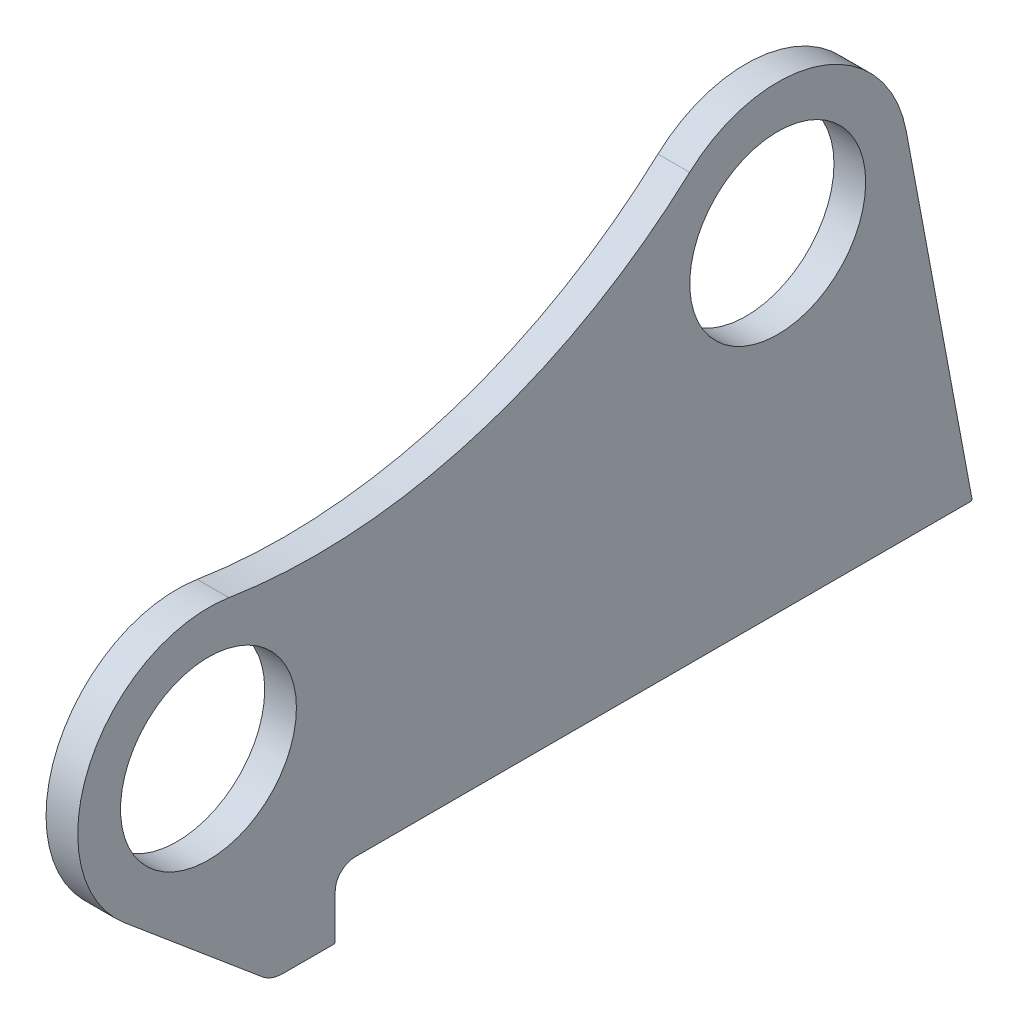
from build123d import *

# Parameters (mm, degrees)
SKETCH1_R          = 55.5
BASE_FLANGE1_DEPTH = 20
FILLET_1_0_R       = 1


# Sheet-metal steps are written as plain solids
with BuildPart() as part:
    # Sketch1 → Base-Flange1 (new body)
    with BuildSketch(Plane(origin=(0, 0, 0), x_dir=(0, 0, -1), z_dir=(1, 0, 0))):
        with BuildLine():
            Line((0, -41), (0, -12.5))
            ThreePointArc((0, -12.5), (3.661165235, -3.661165235), (12.5, 0))
            Line((12.5, 0), (402, 0))
            Line((402, 0), (360.323614104, 222.774084629))
            ThreePointArc((360.323614104, 222.774084629), (305.433470455, 285.831465011), (223.63616123, 268.558327081))
            ThreePointArc((223.63616123, 268.558327081), (88.211160813, 191.873835227), (-67.07058856, 181.480551789))
            ThreePointArc((-67.07058856, 181.480551789), (-155.059207322, 134.23982179), (-133.058215758, 36.825038658))
            Line((-133.058215758, 36.825038658), (-45.972209781, -36.315142143))
            ThreePointArc((-45.972209781, -36.315142143), (-39.95421417, -39.792323471), (-33.109612021, -41))
            Line((-33.109612021, -41), (0, -41))
        make_face()
        with Locations((-80, 100)):
            Circle(SKETCH1_R, mode=Mode.SUBTRACT)
        with Locations((279.230483668, 207.603250897)):
            Circle(SKETCH1_R, mode=Mode.SUBTRACT)
    extrude(amount=-BASE_FLANGE1_DEPTH)

    # Fillet-1.0
    fillet_1_0_edges = [part.edges().sort_by_distance(p)[0] for p in [
        (-10, 0, -402),
        (-10, -41, 0),
    ]]
    fillet(fillet_1_0_edges, radius=FILLET_1_0_R)


solid = part.part
